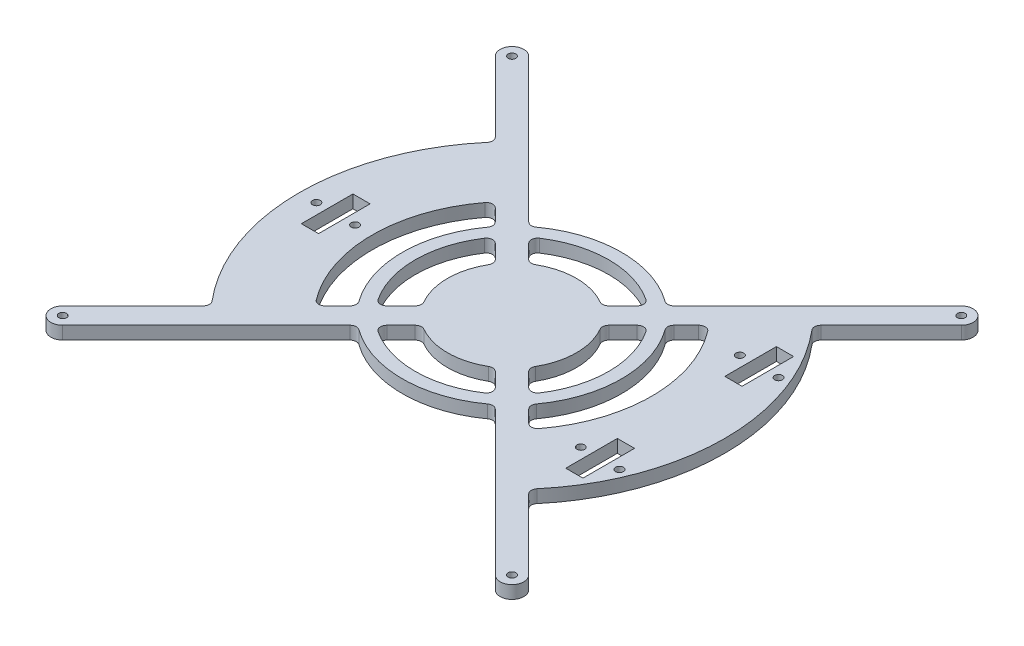
from build123d import *

# Parameters (mm, degrees)
SKETCH1_W           = 220
SKETCH1_H           = 220
SKETCH1_R           = 1.8
SKETCH1_W_2         = 8
SKETCH1_H_2         = 24
BOSS_EXTRUDE1_DEPTH = 3
CUT_EXTRUDE1_DEPTH  = 10
FILLET1_R           = 3


with BuildPart() as part:
    # Sketch1 → Boss-Extrude1 (new, symmetric)
    with BuildSketch(Plane(origin=(0, 0, 0), x_dir=(1, 0, 0), z_dir=(0, 1, 0))):
        Rectangle(SKETCH1_W, SKETCH1_H)
        with Locations((-104.5, 104.5)):
            Circle(SKETCH1_R, mode=Mode.SUBTRACT)
        with Locations((104.5, 104.5)):
            Circle(SKETCH1_R, mode=Mode.SUBTRACT)
        with Locations((104.5, -104.5)):
            Circle(SKETCH1_R, mode=Mode.SUBTRACT)
        with Locations((-104.5, -104.5)):
            Circle(SKETCH1_R, mode=Mode.SUBTRACT)
        with Locations((-73, 0)):
            Circle(SKETCH1_R, mode=Mode.SUBTRACT)
        with Locations((-91, 0)):
            Circle(SKETCH1_R, mode=Mode.SUBTRACT)
        with Locations((87, 37)):
            Circle(SKETCH1_R, mode=Mode.SUBTRACT)
        with Locations((69, 37)):
            Circle(SKETCH1_R, mode=Mode.SUBTRACT)
        with Locations((87, -37)):
            Circle(SKETCH1_R, mode=Mode.SUBTRACT)
        with Locations((69, -37)):
            Circle(SKETCH1_R, mode=Mode.SUBTRACT)
        with Locations((-82, 0)):
            Rectangle(SKETCH1_W_2, SKETCH1_H_2, mode=Mode.SUBTRACT)
        with Locations((78, 37)):
            Rectangle(SKETCH1_W_2, SKETCH1_H_2, mode=Mode.SUBTRACT)
        with Locations((78, -37)):
            Rectangle(SKETCH1_W_2, SKETCH1_H_2, mode=Mode.SUBTRACT)
    extrude(amount=BOSS_EXTRUDE1_DEPTH, both=True)

    # Sketch2 → Cut-Extrude1 (cut)
    with BuildSketch(Plane.XZ.offset(3)):
        with BuildLine():
            Line((-104.500000026, 110), (-110, 110))
            Line((-110, 110), (-110, 104.5))
            ThreePointArc((-110, 104.5), (-108.389087306, 108.389087287), (-104.500000026, 110))
        make_face()
        with BuildLine():
            Line((104.5, 110), (-104.500000026, 110))
            ThreePointArc((-104.500000026, 110), (-102.395241134, 109.581337434), (-100.610912703, 108.389087297))
            Line((-100.610912703, 108.389087297), (-31.963039558, 39.741214151))
            ThreePointArc((-31.963039558, 39.741214151), (0, 51), (31.963039558, 39.741214151))
            Line((31.963039558, 39.741214151), (100.610912703, 108.389087297))
            ThreePointArc((100.610912703, 108.389087297), (102.395241122, 109.581337429), (104.5, 110))
        make_face()
        with BuildLine():
            ThreePointArc((-108.389087297, 100.610912703), (-109.581337429, 102.395241122), (-110, 104.5))
            Line((-110, 104.5), (-110, -104.50000001))
            ThreePointArc((-110, -104.50000001), (-109.581337431, -102.395241127), (-108.389087297, -100.610912703))
            Line((-108.389087297, -100.610912703), (-73.784544946, -66.006370353))
            ThreePointArc((-73.784544946, -66.006370353), (-99, 0), (-73.784544946, 66.006370353))
            Line((-73.784544946, 66.006370353), (-108.389087297, 100.610912703))
        make_face()
        with BuildLine():
            Line((110, 110), (104.5, 110))
            ThreePointArc((104.5, 110), (108.389087297, 108.389087297), (110, 104.5))
            Line((110, 104.5), (110, 110))
        make_face()
        with BuildLine():
            ThreePointArc((-104.5, -110), (-108.389087293, -108.3890873), (-110, -104.50000001))
            Line((-110, -104.50000001), (-110, -110))
            Line((-110, -110), (-104.5, -110))
        make_face()
        with BuildLine():
            Line((110, -104.5), (110, 104.5))
            ThreePointArc((110, 104.5), (109.581337429, 102.395241122), (108.389087297, 100.610912703))
            Line((108.389087297, 100.610912703), (73.784544946, 66.006370353))
            ThreePointArc((73.784544946, 66.006370353), (99, 0), (73.784544946, -66.006370353))
            Line((73.784544946, -66.006370353), (108.389087297, -100.610912703))
            ThreePointArc((108.389087297, -100.610912703), (109.581337429, -102.395241122), (110, -104.5))
        make_face()
        with BuildLine():
            ThreePointArc((-100.610912703, -108.389087297), (-102.395241122, -109.581337429), (-104.5, -110))
            Line((-104.5, -110), (104.5, -110))
            ThreePointArc((104.5, -110), (102.395241122, -109.581337429), (100.610912703, -108.389087297))
            Line((100.610912703, -108.389087297), (31.963039558, -39.741214151))
            ThreePointArc((31.963039558, -39.741214151), (0, -51), (-31.963039558, -39.741214151))
            Line((-31.963039558, -39.741214151), (-100.610912703, -108.389087297))
        make_face()
        with BuildLine():
            Line((110, -110), (110, -104.5))
            ThreePointArc((110, -104.5), (108.389087297, -108.389087297), (104.5, -110))
            Line((104.5, -110), (110, -110))
        make_face()
        with BuildLine():
            Line((-39.741214151, 31.963039558), (-49.686194192, 41.908019599))
            ThreePointArc((-49.686194192, 41.908019599), (-65, 0), (-49.686194192, -41.908019599))
            Line((-49.686194192, -41.908019599), (-39.741214151, -31.963039558))
            ThreePointArc((-39.741214151, -31.963039558), (-51, 0), (-39.741214151, 31.963039558))
        make_face()
        with BuildLine():
            ThreePointArc((49.686194192, -41.908019599), (65, 0), (49.686194192, 41.908019599))
            Line((49.686194192, 41.908019599), (39.741214151, 31.963039558))
            ThreePointArc((39.741214151, 31.963039558), (51, 0), (39.741214151, -31.963039558))
            Line((39.741214151, -31.963039558), (49.686194192, -41.908019599))
        make_face()
        with BuildLine():
            ThreePointArc((27.692157137, 35.470331731), (0, 45), (-27.692157137, 35.470331731))
            Line((-27.692157137, 35.470331731), (-16.964569457, 24.74274405))
            ThreePointArc((-16.964569457, 24.74274405), (0, 30), (16.964569457, 24.74274405))
            Line((16.964569457, 24.74274405), (27.692157137, 35.470331731))
        make_face()
        with BuildLine():
            Line((-24.74274405, 16.964569457), (-35.470331731, 27.692157137))
            ThreePointArc((-35.470331731, 27.692157137), (-45, 0), (-35.470331731, -27.692157137))
            Line((-35.470331731, -27.692157137), (-24.74274405, -16.964569457))
            ThreePointArc((-24.74274405, -16.964569457), (-30, 0), (-24.74274405, 16.964569457))
        make_face()
        with BuildLine():
            ThreePointArc((35.470331731, -27.692157137), (45, 0), (35.470331731, 27.692157137))
            Line((35.470331731, 27.692157137), (24.74274405, 16.964569457))
            ThreePointArc((24.74274405, 16.964569457), (30, 0), (24.74274405, -16.964569457))
            Line((24.74274405, -16.964569457), (35.470331731, -27.692157137))
        make_face()
        with BuildLine():
            Line((-16.964569457, -24.74274405), (-27.692157137, -35.470331731))
            ThreePointArc((-27.692157137, -35.470331731), (0, -45), (27.692157137, -35.470331731))
            Line((27.692157137, -35.470331731), (16.964569457, -24.74274405))
            ThreePointArc((16.964569457, -24.74274405), (0, -30), (-16.964569457, -24.74274405))
        make_face()
    extrude(amount=-CUT_EXTRUDE1_DEPTH, mode=Mode.SUBTRACT)

    # Fillet1
    fillet1_edges = [part.edges().sort_by_distance(p)[0] for p in [
        (-73.784544946, 0, -66.006370353),
        (-73.784544946, 0, 66.006370353),
        (-49.686194192, 0, -41.908019599),
        (-49.686194192, 0, 41.908019599),
        (-39.741214151, 0, 31.963039558),
        (-31.963039558, 0, -39.741214151),
        (-39.741214151, 0, -31.963039558),
        (-24.74274405, 0, -16.964569457),
        (-24.74274405, 0, 16.964569457),
        (-35.470331731, 0, 27.692157137),
        (-35.470331731, 0, -27.692157137),
        (-27.692157137, 0, -35.470331731),
        (27.692157137, 0, -35.470331731),
        (-16.964569457, 0, -24.74274405),
        (16.964569457, 0, -24.74274405),
        (31.963039558, 0, -39.741214151),
        (73.784544946, 0, 66.006370353),
        (73.784544946, 0, -66.006370353),
        (49.686194192, 0, 41.908019599),
        (49.686194192, 0, -41.908019599),
        (39.741214151, 0, -31.963039558),
        (24.74274405, 0, -16.964569457),
        (35.470331731, 0, -27.692157137),
        (24.74274405, 0, 16.964569457),
        (16.964569457, 0, 24.74274405),
        (-16.964569457, 0, 24.74274405),
        (35.470331731, 0, 27.692157137),
        (39.741214151, 0, 31.963039558),
        (27.692157137, 0, 35.470331731),
        (31.963039558, 0, 39.741214151),
        (-27.692157137, 0, 35.470331731),
        (-31.963039558, 0, 39.741214151),
    ]]
    fillet(fillet1_edges, radius=FILLET1_R)


solid = part.part
